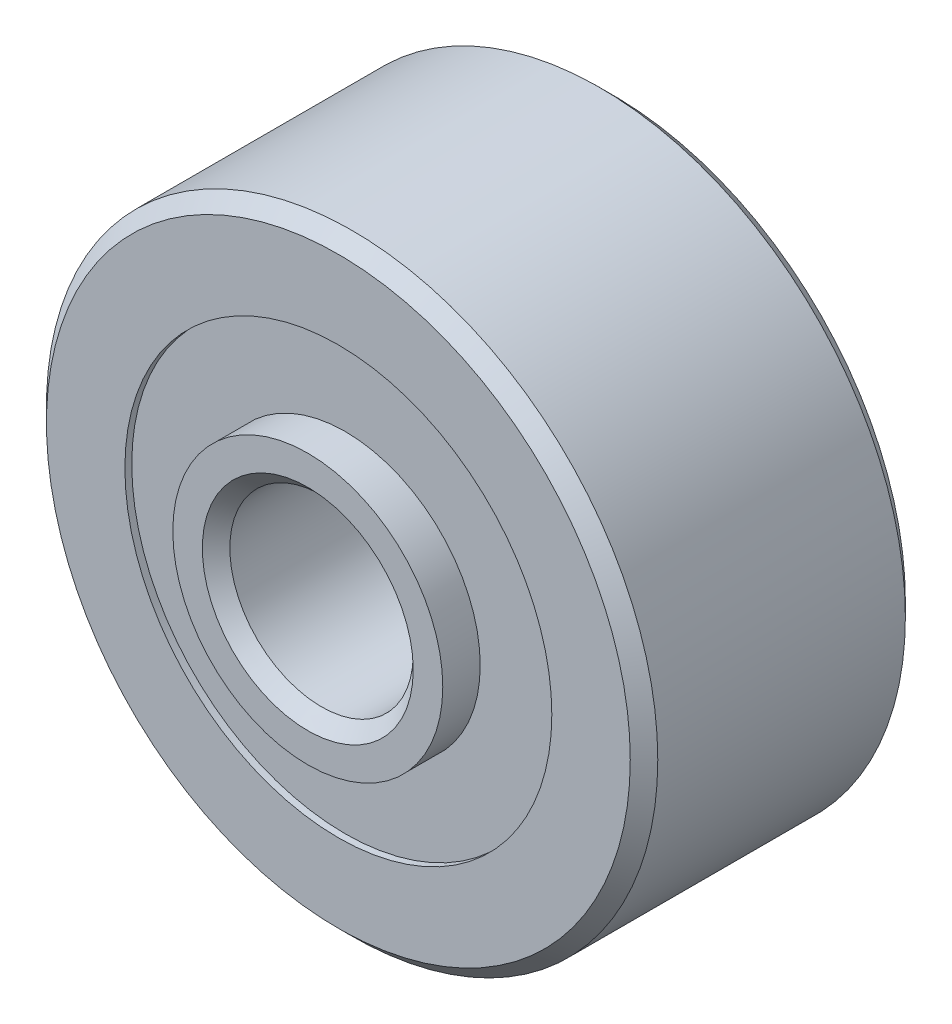
from build123d import *

# Parameters (mm, degrees)
CIRPATTERN1_COUNT = 8
SKETCH5_W         = 0.880023833
SKETCH5_H         = 1.018983104


with BuildPart() as part:
    # Sketch1 → Revolve1 (revolve)
    with BuildSketch(Plane(origin=(0, 0, 0), x_dir=(0, 0, -1), z_dir=(1, 0, 0))):
        with BuildLine():
            Line((1.60734375, 3.96875), (-1.60734375, 3.96875))
            Line((-1.60734375, 3.96875), (-1.7859375, 3.79015625))
            Line((-1.7859375, 3.79015625), (-1.7859375, 2.771583104))
            Line((-1.7859375, 2.771583104), (-0.79375, 2.771583104))
            ThreePointArc((-0.79375, 2.771583104), (0, 3.396304292), (0.79375, 2.771583104))
            Line((0.79375, 2.771583104), (1.7859375, 2.771583104))
            Line((1.7859375, 2.771583104), (1.7859375, 3.79015625))
            Line((1.7859375, 3.79015625), (1.60734375, 3.96875))
        make_face()
    revolve(axis=Axis((0, 0, 1.7859375), (0, 0, -1)))


with BuildPart() as body_2:
    # Sketch3 → Revolve3 (revolve)
    with BuildSketch(Plane(origin=(0, 0, 0), x_dir=(0, 0, -1), z_dir=(1, 0, 0))):
        Polygon((-2.1828125, 1.36921875), (-2.1828125, 1.7526), (2.1828125, 1.7526), (2.1828125, 1.36921875), (2.00421875, 1.190625), (-2.00421875, 1.190625), align=None)
    revolve(axis=Axis((0, 0, 1.7859375), (0, 0, -1)))


with BuildPart() as body_3:
    # Sketch4 → Revolve4 (revolve)
    with BuildSketch(Plane(origin=(0, 0, 0), x_dir=(0, 0, -1), z_dir=(1, 0, 0))):
        with BuildLine():
            Line((-0.816616792, 2.5796875), (0.816616792, 2.5796875))
            ThreePointArc((0.816616792, 2.5796875), (0, 3.396304292), (-0.816616792, 2.5796875))
        make_face()
    revolve(axis=Axis((0, 2.5796875, 0.816616792), (0, 0, -1)))


with BuildPart() as cirpattern1_1:
    # CirPattern1: pattern copy
    add(body_3.part.rotate(Axis((0, 0, -1.7859375), (0, 0, 1)), 1 * 360 / CIRPATTERN1_COUNT))


with BuildPart() as cirpattern1_2:
    # CirPattern1: pattern copy
    add(body_3.part.rotate(Axis((0, 0, -1.7859375), (0, 0, 1)), 2 * 360 / CIRPATTERN1_COUNT))


with BuildPart() as cirpattern1_3:
    # CirPattern1: pattern copy
    add(body_3.part.rotate(Axis((0, 0, -1.7859375), (0, 0, 1)), 3 * 360 / CIRPATTERN1_COUNT))


with BuildPart() as cirpattern1_4:
    # CirPattern1: pattern copy
    add(body_3.part.rotate(Axis((0, 0, -1.7859375), (0, 0, 1)), 4 * 360 / CIRPATTERN1_COUNT))


with BuildPart() as cirpattern1_5:
    # CirPattern1: pattern copy
    add(body_3.part.rotate(Axis((0, 0, -1.7859375), (0, 0, 1)), 5 * 360 / CIRPATTERN1_COUNT))


with BuildPart() as cirpattern1_6:
    # CirPattern1: pattern copy
    add(body_3.part.rotate(Axis((0, 0, -1.7859375), (0, 0, 1)), 6 * 360 / CIRPATTERN1_COUNT))


with BuildPart() as cirpattern1_7:
    # CirPattern1: pattern copy
    add(body_3.part.rotate(Axis((0, 0, -1.7859375), (0, 0, 1)), 7 * 360 / CIRPATTERN1_COUNT))


with BuildPart() as body_11:
    # Sketch5 → Revolve5 (revolve)
    with BuildSketch(Plane(origin=(0, 0, 0), x_dir=(0, 0, -1), z_dir=(1, 0, 0))):
        with Locations((-1.256628709, 2.262091552)):
            Rectangle(SKETCH5_W, SKETCH5_H)
        with Locations((1.256628709, 2.262091552)):
            Rectangle(SKETCH5_W, SKETCH5_H)
    revolve(axis=Axis((0, 0, 1.7859375), (0, 0, -1)))


solid = Compound([part.part, body_2.part, body_3.part, cirpattern1_1.part, cirpattern1_2.part, cirpattern1_3.part, cirpattern1_4.part, cirpattern1_5.part, cirpattern1_6.part, cirpattern1_7.part, body_11.part])
